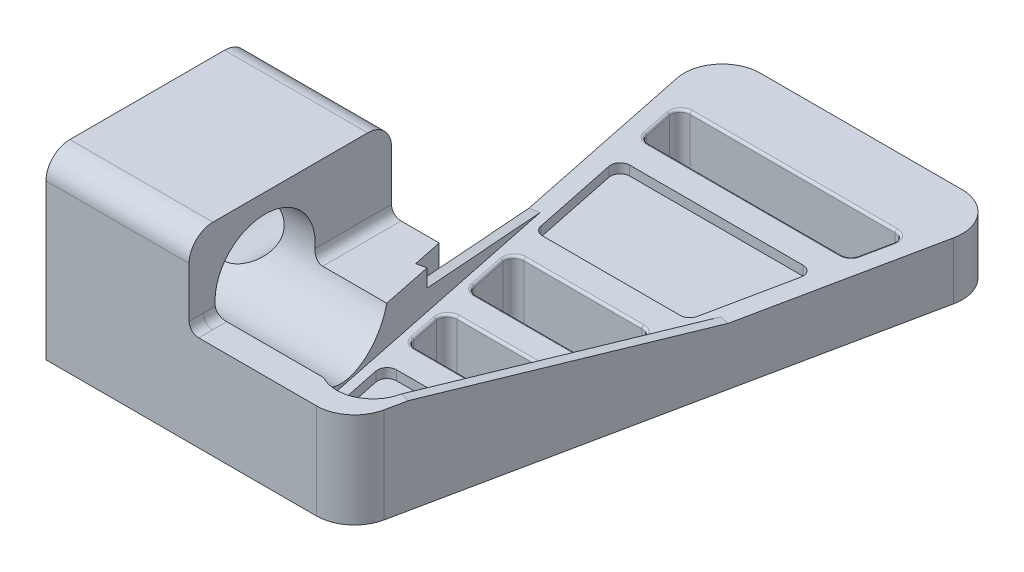
from build123d import *

# Parameters (mm, degrees)
BOSS_EXTRUDE1_DEPTH = 6
CUT_EXTRUDE2_DEPTH  = 4
CUT_EXTRUDE6_REACH  = 72.533
CUT_EXTRUDE7_REACH  = 67.666
CUT_EXTRUDE8_REACH  = 64.884
SKETCH12_W          = 29.165933261
SKETCH12_H          = 4
CUT_EXTRUDE9_DEPTH  = 1
CUT_EXTRUDE10_DEPTH = 1
CUT_EXTRUDE11_DEPTH = 72.2485233
FILLET1_R           = 0.25
BOSS_EXTRUDE2_START = -6
BOSS_EXTRUDE2_DEPTH = 6
SKETCH17_W          = 15
SKETCH17_H          = 19.75
BOSS_EXTRUDE3_DEPTH = 17
SKETCH18_R          = 5.25
CUT_EXTRUDE12_DEPTH = 27.994932009
CUT_EXTRUDE15_DEPTH = 15
BOSS_EXTRUDE4_DEPTH = 4
SKETCH45_R          = 4.25
CUT_EXTRUDE16_DEPTH = 59.73876273
BOSS_EXTRUDE5_DEPTH = 10
LOFT3_START         = -4
LOFT3_DEPTH         = 10
LOFT3_START_2       = 6
LOFT3_2_OUTLINE_W   = 15
LOFT3_2_OUTLINE_H   = 1.468887514
LOFT3_2_DEPTH       = 8.75
FILLET3_R           = 1
FILLET4_R           = 4
CUT_EXTRUDE17_DEPTH = 1
FILLET5_R           = 2.5


# Read off the part's stored shape, not the designer's step: Loft3
with BuildPart() as part:
    # Sketch1 → Boss-Extrude1 (new body)
    with BuildSketch(Plane(origin=(0, 0, 0), x_dir=(1, 0, 0), z_dir=(0, 1, 0))):
        with BuildLine():
            Line((-27.888979083, 60.595365343), (-18.089419127, 13.233272829))
            ThreePointArc((-18.089419127, 13.233272829), (-13.388979083, 9.405827916), (-8.68853904, 13.233272829))
            Line((-8.68853904, 13.233272829), (1.111020917, 60.595365343))
            ThreePointArc((1.111020917, 60.595365343), (0.295749167, 63.931510963), (-2.806012453, 65.405827916))
            Line((-2.806012453, 65.405827916), (-23.971945714, 65.405827916))
            ThreePointArc((-23.971945714, 65.405827916), (-27.073707333, 63.931510963), (-27.888979083, 60.595365343))
        make_face()
    extrude(amount=BOSS_EXTRUDE1_DEPTH)

    # Sketch4 → Cut-Extrude2 (cut)
    with BuildSketch(Plane(origin=(0, 6, 0), x_dir=(1, 0, 0), z_dir=(0, 1, 0))):
        with BuildLine():
            Line((-9.667797382, 13.435888472), (0.131762574, 60.797980986))
            ThreePointArc((0.131762574, 60.797980986), (-0.479691238, 63.300090201), (-2.806012453, 64.405827916))
            Line((-2.806012453, 64.405827916), (-23.971945714, 64.405827916))
            ThreePointArc((-23.971945714, 64.405827916), (-26.298266928, 63.300090201), (-26.909720741, 60.797980986))
            Line((-26.909720741, 60.797980986), (-17.110160784, 13.435888472))
            ThreePointArc((-17.110160784, 13.435888472), (-13.388979083, 10.405827916), (-9.667797382, 13.435888472))
        make_face()
    extrude(amount=-CUT_EXTRUDE2_DEPTH, mode=Mode.SUBTRACT)

    # Cut-Extrude6: up to this face of the body (flat: up to its plane)
    cut_extrude6_end = Plane(part.part.faces().sort_by_distance((-22.009940762, 4, -37.116934729))[0])
    # Sketch10 → Cut-Extrude6 (cut, up to the picked face)
    with BuildSketch(Plane(origin=(-14.721138273, 0, 3.045910125), x_dir=(0.20261564322099923, 0, 0.9792583423806717), z_dir=(-0.9792583423806717, 0, 0.20261564322099923)), mode=Mode.PRIVATE) as cut_extrude6_sk1:
        Polygon((-64.989260458, 6), (-64.989260458, 2), (-44.989260458, 2), (-16.623992106, 6), align=None)
    cut_extrude6_tool1 = split(extrude(cut_extrude6_sk1.sketch, amount=-CUT_EXTRUDE6_REACH, mode=Mode.PRIVATE), bisect_by=cut_extrude6_end, keep=Keep.BOTH, mode=Mode.PRIVATE)
    add(cut_extrude6_tool1.solids().sort_by(Axis((-24.227296, 4.276605, -42.898146), (0.9792583423806717, 0, -0.20261564322099923)))[0], mode=Mode.SUBTRACT)

    # Cut-Extrude7: up to this face of the body (flat: up to its plane)
    cut_extrude7_end = Plane(part.part.faces().sort_by_distance((-4.768017404, 4, -37.116934729))[0])
    # Sketch11 → Cut-Extrude7 (cut, up to the picked face)
    with BuildSketch(Plane(origin=(-10.957501729, 0, -2.267186466), x_dir=(0.20261564322099948, 0, -0.9792583423806717), z_dir=(0.9792583423806716, 0, 0.20261564322099945)), mode=Mode.PRIVATE) as cut_extrude7_sk1:
        Polygon((24.288358888, 6), (24.288358888, 4.15408057), (39.56362724, 2), (59.56362724, 2), (59.56362724, 6), align=None)
    cut_extrude7_tool1 = split(extrude(cut_extrude7_sk1.sketch, amount=-CUT_EXTRUDE7_REACH, mode=Mode.PRIVATE), bisect_by=cut_extrude7_end, keep=Keep.BOTH, mode=Mode.PRIVATE)
    add(cut_extrude7_tool1.solids().sort_by(Axis((-2.127129, 4.169204, -44.945115), (-0.9792583423806716, 0, -0.20261564322099945)))[0], mode=Mode.SUBTRACT)

    # Sketch12 → Cut-Extrude8 (cut, up to next)
    with BuildSketch(Plane(origin=(0, 0, -65.405827916), x_dir=(-1, 0, 0), z_dir=(0, 0, -1)), mode=Mode.PRIVATE) as cut_extrude8_sk1:
        with Locations((13.388979084, 4)):
            Rectangle(SKETCH12_W, SKETCH12_H)
    cut_extrude8_tool1 = extrude(cut_extrude8_sk1.sketch, amount=-CUT_EXTRUDE8_REACH, mode=Mode.PRIVATE) & part.part
    add(cut_extrude8_tool1.solids().sort_by_distance((-13.388979, 4, -65.405828))[0], mode=Mode.SUBTRACT)

    # Sketch13 → Cut-Extrude9 (cut)
    with BuildSketch(Plane(origin=(0, 2, 0), x_dir=(1, 0, 0), z_dir=(0, 1, 0))):
        with BuildLine():
            Line((-16.096115277, 19.405827916), (-10.68184289, 19.405827916))
            ThreePointArc((-10.68184289, 19.405827916), (-9.906402485, 19.037248678), (-9.702584547, 18.203212273))
            Line((-9.702584547, 18.203212273), (-10.647055724, 13.638504115))
            ThreePointArc((-10.647055724, 13.638504115), (-13.388979083, 11.405827916), (-16.130902442, 13.638504115))
            Line((-16.130902442, 13.638504115), (-17.075373619, 18.203212273))
            ThreePointArc((-17.075373619, 18.203212273), (-16.871555682, 19.037248678), (-16.096115277, 19.405827916))
        make_face()
    extrude(amount=-CUT_EXTRUDE9_DEPTH, mode=Mode.SUBTRACT)

    # Sketch14 → Cut-Extrude10 (cut)
    with BuildSketch(Plane(origin=(0, 2, 0), x_dir=(1, 0, 0), z_dir=(0, 1, 0))):
        with BuildLine():
            Line((-20.608138661, 39.212814139), (-6.169819505, 39.212814139))
            ThreePointArc((-6.169819505, 39.212814139), (-5.538398743, 39.437373734), (-5.190561163, 40.010198495))
            Line((-5.190561163, 40.010198495), (-3.328395981, 49.010198495))
            ThreePointArc((-3.328395981, 49.010198495), (-3.532213919, 49.8442349), (-4.307654323, 50.212814139))
            Line((-4.307654323, 50.212814139), (-22.470303843, 50.212814139))
            ThreePointArc((-22.470303843, 50.212814139), (-23.245744248, 49.8442349), (-23.449562185, 49.010198495))
            Line((-23.449562185, 49.010198495), (-21.587397004, 40.010198495))
            ThreePointArc((-21.587397004, 40.010198495), (-21.239559423, 39.437373734), (-20.608138661, 39.212814139))
        make_face()
    extrude(amount=-CUT_EXTRUDE10_DEPTH, mode=Mode.SUBTRACT)

    # Sketch15 → Cut-Extrude11 (cut, through all)
    with BuildSketch(Plane(origin=(0, 2, 0), x_dir=(1, 0, 0), z_dir=(0, 1, 0))):
        with BuildLine():
            Line((-19.573602449, 36.212814139), (-7.204355717, 36.212814139))
            ThreePointArc((-7.204355717, 36.212814139), (-6.428915312, 35.8442349), (-6.225097375, 35.010198495))
            Line((-6.225097375, 35.010198495), (-7.012790396, 31.203212273))
            ThreePointArc((-7.012790396, 31.203212273), (-7.360627977, 30.630387511), (-7.992048738, 30.405827916))
            Line((-7.992048738, 30.405827916), (-18.785909428, 30.405827916))
            ThreePointArc((-18.785909428, 30.405827916), (-19.41733019, 30.630387511), (-19.76516777, 31.203212273))
            Line((-19.76516777, 31.203212273), (-20.552860792, 35.010198495))
            ThreePointArc((-20.552860792, 35.010198495), (-20.349042854, 35.8442349), (-19.573602449, 36.212814139))
        make_face()
        with BuildLine():
            Line((-17.751373216, 27.405827916), (-9.02658495, 27.405827916))
            ThreePointArc((-9.02658495, 27.405827916), (-8.251144545, 27.037248678), (-8.047326608, 26.203212273))
            Line((-8.047326608, 26.203212273), (-8.668048335, 23.203212273))
            ThreePointArc((-8.668048335, 23.203212273), (-9.015885916, 22.630387511), (-9.647306678, 22.405827916))
            Line((-9.647306678, 22.405827916), (-17.130651489, 22.405827916))
            ThreePointArc((-17.130651489, 22.405827916), (-17.76207225, 22.630387511), (-18.109909831, 23.203212273))
            Line((-18.109909831, 23.203212273), (-18.730631558, 26.203212273))
            ThreePointArc((-18.730631558, 26.203212273), (-18.526813621, 27.037248678), (-17.751373216, 27.405827916))
        make_face()
        with BuildLine():
            Line((-2.293859769, 54.010198495), (-1.673138042, 57.010198495))
            ThreePointArc((-1.673138042, 57.010198495), (-1.876955979, 57.8442349), (-2.652396384, 58.212814139))
            Line((-2.652396384, 58.212814139), (-24.125561782, 58.212814139))
            ThreePointArc((-24.125561782, 58.212814139), (-24.901002187, 57.8442349), (-25.104820124, 57.010198495))
            Line((-25.104820124, 57.010198495), (-24.484098397, 54.010198495))
            ThreePointArc((-24.484098397, 54.010198495), (-24.136260817, 53.437373734), (-23.504840055, 53.212814139))
            Line((-23.504840055, 53.212814139), (-3.273118111, 53.212814139))
            ThreePointArc((-3.273118111, 53.212814139), (-2.64169735, 53.437373734), (-2.293859769, 54.010198495))
        make_face()
    extrude(amount=-CUT_EXTRUDE11_DEPTH, mode=Mode.SUBTRACT)

    # Fillet1
    fillet1_edges = [part.edges().sort_by_distance(p)[0] for p in [
        (-9.015885916, 2, -22.630387511),
        (-8.357687472, 2, -24.703212273),
        (-8.251144545, 2, -27.037248678),
        (-13.388979083, 2, -27.405827916),
        (-18.526813621, 2, -27.037248678),
        (-18.420270695, 2, -24.703212273),
        (-17.76207225, 2, -22.630387511),
        (-13.388979083, 2, -22.405827916),
        (-7.360627977, 2, -30.630387511),
        (-6.618943885, 2, -33.106705384),
        (-6.428915312, 2, -35.8442349),
        (-13.388979083, 2, -36.212814139),
        (-20.349042854, 2, -35.8442349),
        (-20.159014281, 2, -33.106705384),
        (-19.41733019, 2, -30.630387511),
        (-13.388979083, 2, -30.405827916),
        (-2.64169735, 2, -53.437373734),
        (-1.983498905, 2, -55.510198495),
        (-1.876955979, 2, -57.8442349),
        (-13.388979083, 2, -58.212814139),
        (-24.901002187, 2, -57.8442349),
        (-24.794459261, 2, -55.510198495),
        (-24.136260817, 2, -53.437373734),
        (-13.388979083, 2, -53.212814139),
    ]]
    fillet(fillet1_edges, radius=FILLET1_R)

    # Sketch16 → Boss-Extrude2 (add)
    with BuildSketch(Plane.XZ.offset(BOSS_EXTRUDE2_START)):
        with BuildLine():
            Line((-13.388979083, -9.405827916), (-0.394047075, -9.405827916))
            Line((-0.394047075, -9.405827916), (-0.394047075, -29.155827916))
            Line((-0.394047075, -29.155827916), (-5.394047075, -29.155827916))
            Line((-5.394047075, -29.155827916), (-8.68853904, -13.233272829))
            ThreePointArc((-8.68853904, -13.233272829), (-10.358159427, -10.483713972), (-13.388979083, -9.405827916))
        make_face()
    extrude(amount=BOSS_EXTRUDE2_DEPTH)

    # Sketch17 → Boss-Extrude3 (add)
    with BuildSketch(Plane(origin=(0, 0, 0), x_dir=(1, 0, 0), z_dir=(0, 1, 0))):
        with Locations((7.105952925, 19.280827916)):
            Rectangle(SKETCH17_W, SKETCH17_H)
    extrude(amount=BOSS_EXTRUDE3_DEPTH)

    # Sketch18 → Cut-Extrude12 (cut)
    with BuildSketch(Plane(origin=(-13.388979083, 0, 0), x_dir=(0, 0, -1), z_dir=(1, 0, 0))):
        with Locations(Location((15.905827916, 7.5, 0), (0, 0, 180))):
            Circle(SKETCH18_R)
    extrude(amount=CUT_EXTRUDE12_DEPTH, mode=Mode.SUBTRACT)

    # Sketch21 → Cut-Extrude15 (cut)
    with BuildSketch(Plane.ZY.offset(0.394047075)):
        Polygon((-9.405827916, 14.75), (-9.405827916, 17), (-29.155827916, 17), (-29.155827916, 14.75), (-15.905827916, 14.75), align=None)
    extrude(amount=-CUT_EXTRUDE15_DEPTH, mode=Mode.SUBTRACT)

    # Sketch41 → Boss-Extrude4 (add)
    with BuildSketch(Plane.XZ):
        with BuildLine():
            Line((1.111020917, -60.595365343), (-5.394047075, -29.155827916))
            Line((-5.394047075, -29.155827916), (14.605952925, -29.155827916))
            Line((14.605952925, -29.155827916), (14.605952925, -9.405827916))
            Line((14.605952925, -9.405827916), (-13.388979083, -9.405827916))
            ThreePointArc((-13.388979083, -9.405827916), (-16.41979874, -10.483713972), (-18.089419127, -13.233272829))
            Line((-18.089419127, -13.233272829), (-27.888979083, -60.595365343))
            ThreePointArc((-27.888979083, -60.595365343), (-27.073707333, -63.931510963), (-23.971945714, -65.405827916))
            Line((-23.971945714, -65.405827916), (-2.806012453, -65.405827916))
            ThreePointArc((-2.806012453, -65.405827916), (0.295749167, -63.931510963), (1.111020917, -60.595365343))
        make_face()
        with BuildLine():
            Line((-17.130651489, -22.405827916), (-9.647306678, -22.405827916))
            ThreePointArc((-9.647306678, -22.405827916), (-9.015885916, -22.630387511), (-8.668048335, -23.203212273))
            Line((-8.668048335, -23.203212273), (-8.047326608, -26.203212273))
            ThreePointArc((-8.047326608, -26.203212273), (-8.251144545, -27.037248678), (-9.02658495, -27.405827916))
            Line((-9.02658495, -27.405827916), (-17.751373216, -27.405827916))
            ThreePointArc((-17.751373216, -27.405827916), (-18.526813621, -27.037248678), (-18.730631558, -26.203212273))
            Line((-18.730631558, -26.203212273), (-18.109909831, -23.203212273))
            ThreePointArc((-18.109909831, -23.203212273), (-17.76207225, -22.630387511), (-17.130651489, -22.405827916))
        make_face(mode=Mode.SUBTRACT)
        with BuildLine():
            Line((-18.785909428, -30.405827916), (-7.992048738, -30.405827916))
            ThreePointArc((-7.992048738, -30.405827916), (-7.360627977, -30.630387511), (-7.012790396, -31.203212273))
            Line((-7.012790396, -31.203212273), (-6.225097375, -35.010198495))
            ThreePointArc((-6.225097375, -35.010198495), (-6.428915312, -35.8442349), (-7.204355717, -36.212814139))
            Line((-7.204355717, -36.212814139), (-19.573602449, -36.212814139))
            ThreePointArc((-19.573602449, -36.212814139), (-20.349042854, -35.8442349), (-20.552860792, -35.010198495))
            Line((-20.552860792, -35.010198495), (-19.76516777, -31.203212273))
            ThreePointArc((-19.76516777, -31.203212273), (-19.41733019, -30.630387511), (-18.785909428, -30.405827916))
        make_face(mode=Mode.SUBTRACT)
        with BuildLine():
            Line((-25.104820124, -57.010198495), (-24.484098397, -54.010198495))
            ThreePointArc((-24.484098397, -54.010198495), (-24.136260817, -53.437373734), (-23.504840055, -53.212814139))
            Line((-23.504840055, -53.212814139), (-3.273118111, -53.212814139))
            ThreePointArc((-3.273118111, -53.212814139), (-2.64169735, -53.437373734), (-2.293859769, -54.010198495))
            Line((-2.293859769, -54.010198495), (-1.673138042, -57.010198495))
            ThreePointArc((-1.673138042, -57.010198495), (-1.876955979, -57.8442349), (-2.652396384, -58.212814139))
            Line((-2.652396384, -58.212814139), (-24.125561782, -58.212814139))
            ThreePointArc((-24.125561782, -58.212814139), (-24.901002187, -57.8442349), (-25.104820124, -57.010198495))
        make_face(mode=Mode.SUBTRACT)
    extrude(amount=BOSS_EXTRUDE4_DEPTH)

    # Sketch45 → Cut-Extrude16 (cut, through all)
    with BuildSketch(Plane.XY.offset(-15.905827916)):
        with Locations((7.105952925, 7.5)):
            Circle(SKETCH45_R)
    extrude(amount=-CUT_EXTRUDE16_DEPTH, mode=Mode.SUBTRACT)

    # Sketch48 → Boss-Extrude5 (add)
    with BuildSketch(Plane.XZ.offset(4)):
        with BuildLine():
            Line((-18.089419127, -13.233272829), (-17.297493054, -9.405827916))
            Line((-17.297493054, -9.405827916), (-13.388979083, -9.405827916))
            ThreePointArc((-13.388979083, -9.405827916), (-16.41979874, -10.483713972), (-18.089419127, -13.233272829))
        make_face()
    extrude(amount=-BOSS_EXTRUDE5_DEPTH)

    # Loft3 outline → Loft3 (add)
    with BuildSketch(Plane(origin=(0, 0, 0), x_dir=(1, 0, 0), z_dir=(0, 1, 0)).offset(LOFT3_START)):
        Polygon((14.605952925, 7.936940402), (14.605952925, 9.405827916), (-17.297493054, 9.405827916), (-16.993569589, 7.936940402), align=None)
    extrude(amount=LOFT3_DEPTH)

    # Loft3 2 outline → Loft3 2 (add)
    with BuildSketch(Plane(origin=(0, 0, 0), x_dir=(1, 0, 0), z_dir=(0, 1, 0)).offset(LOFT3_START_2)):
        with Locations((7.105952925, 8.671384159)):
            Rectangle(LOFT3_2_OUTLINE_W, LOFT3_2_OUTLINE_H)
    extrude(amount=LOFT3_2_DEPTH)

    # Fillet3
    fillet3_edges = [part.edges().sort_by_distance(p)[0] for p in [
        (-0.394047075, 6, -8.671384159),
        (-0.394047075, 6, -10.140251441),
        (-0.394047075, 6, -25.046404391),
    ]]
    fillet(fillet3_edges, radius=FILLET3_R)

    # Fillet4
    fillet4_edges = [part.edges().sort_by_distance(p)[0] for p in [
        (-16.993569589, 1, -7.936940402),
    ]]
    fillet(fillet4_edges, radius=FILLET4_R)

    # Sketch52 → Cut-Extrude17 (cut)
    with BuildSketch(Plane(origin=(14.605952925, 0, 0), x_dir=(0, 0, -1), z_dir=(1, 0, 0))):
        Polygon((21.655827916, 4.468911087), (20.550058685, 5.051812801), (20.348135608, 4.702071772), (21.405827916, 4.035898385), align=None)
        Polygon((19.889344799, 2.363698486), (20.272367021, 2.685092291), (19.432647962, 3.611036081), (19.12328386, 3.351448777), align=None)
        Polygon((17.892390756, 1.311012354), (18.362237067, 1.482022426), (17.889850691, 2.639325805), (17.510359441, 2.501202286), align=None)
        Polygon((15.655827916, 1.004809472), (16.155827916, 1.004809472), (16.107750993, 2.253884573), (15.703904839, 2.253884573), align=None)
        Polygon((13.449418765, 1.482022426), (13.919265076, 1.311012354), (14.301296391, 2.501202286), (13.92180514, 2.639325805), align=None)
        Polygon((11.539288811, 2.685092291), (11.922311033, 2.363698486), (12.688371972, 3.351448777), (12.37900787, 3.611036081), align=None)
        Polygon((10.155827916, 4.468911087), (10.405827916, 4.035898385), (11.463520224, 4.702071772), (11.261597147, 5.051812801), align=None)
        Polygon((9.465901882, 6.618323939), (9.552725971, 6.125920063), (10.774476345, 6.390166205), (10.704349196, 6.787877028), align=None)
        Polygon((9.552725971, 8.874079937), (9.465901882, 8.381676061), (10.704349196, 8.212122972), (10.774476345, 8.609833795), align=None)
        Polygon((10.405827916, 10.964101615), (10.155827916, 10.531088913), (11.261597147, 9.948187199), (11.463520224, 10.297928228), align=None)
        Polygon((11.922311033, 12.636301514), (11.539288811, 12.314907709), (12.37900787, 11.388963919), (12.688371972, 11.648551223), align=None)
        Polygon((13.919265076, 13.688987646), (13.449418765, 13.517977574), (13.92180514, 12.360674195), (14.301296391, 12.498797714), align=None)
        Polygon((16.155827916, 13.995190528), (15.655827916, 13.995190528), (15.703904839, 12.746115427), (16.107750993, 12.746115427), align=None)
        Polygon((18.362237067, 13.517977574), (17.892390756, 13.688987646), (17.510359441, 12.498797714), (17.889850691, 12.360674195), align=None)
        Polygon((20.272367021, 12.314907709), (19.889344799, 12.636301514), (19.12328386, 11.648551223), (19.432647962, 11.388963919), align=None)
        Polygon((21.655827916, 10.531088913), (21.405827916, 10.964101615), (20.348135608, 10.297928228), (20.550058685, 9.948187199), align=None)
        Polygon((22.34575395, 8.381676061), (22.258929861, 8.874079937), (21.037179487, 8.609833795), (21.107306636, 8.212122972), align=None)
        Polygon((22.258929861, 6.125920063), (22.34575395, 6.618323939), (21.107306636, 6.787877028), (21.037179487, 6.390166205), align=None)
    extrude(amount=-CUT_EXTRUDE17_DEPTH, mode=Mode.SUBTRACT)

    # Fillet5
    fillet5_edges = [part.edges().sort_by_distance(p)[0] for p in [
        (7.105952925, 14.75, -7.936940402),
        (7.105952925, 14.75, -29.155827916),
    ]]
    fillet(fillet5_edges, radius=FILLET5_R)


with BuildPart() as body_2:
    # Mirror1: mirrored copy
    add(part.part.mirror(Plane(origin=(24.605952925, 0, 0), x_dir=(0, 0, 1), z_dir=(1, 0, 0))))


solid = body_2.part
